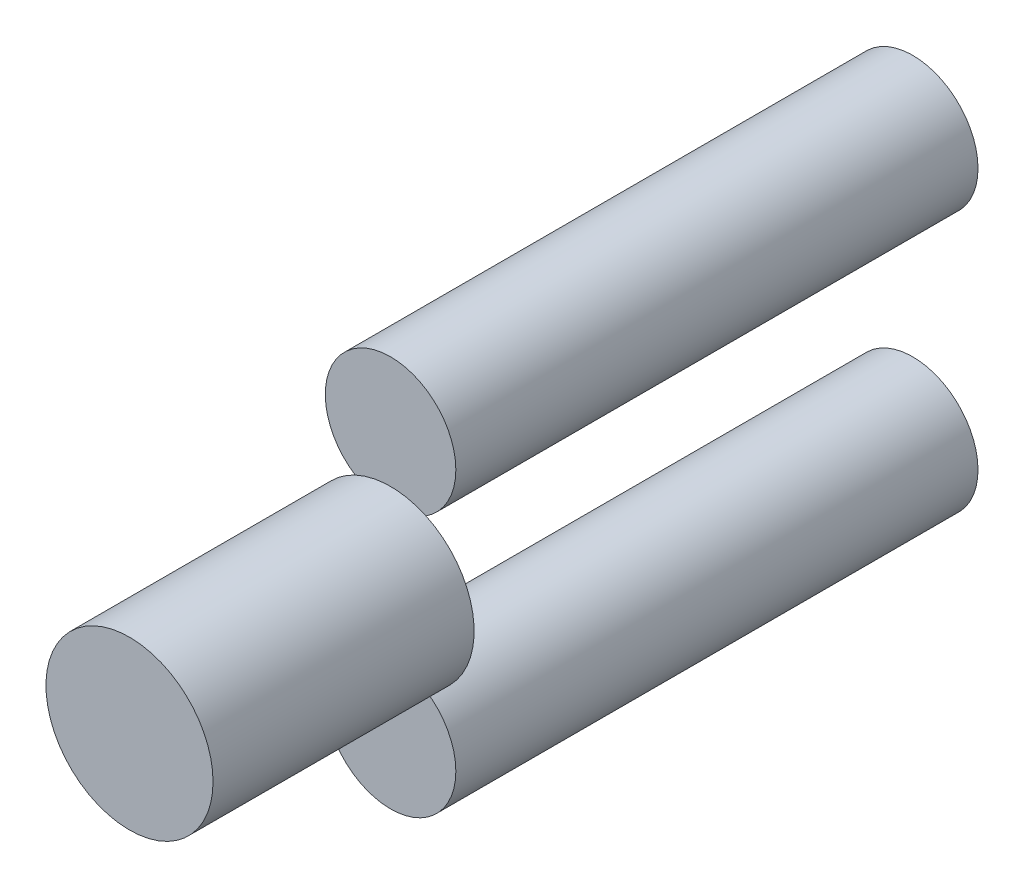
from build123d import *

# Parameters (mm, degrees)
SKETCH1_R             = 1.5875
BOSS_EXTRUDE1_DEPTH   = 12.7
BOSS_EXTRUDE1_2_DEPTH = 12.7
SKETCH2_R             = 2.032
BOSS_EXTRUDE2_DEPTH   = 6.35


with BuildPart() as part:
    # Sketch1 → Boss-Extrude1 (new body)
    with BuildSketch(Plane.XY):
        with Locations((0, 12.7)):
            Circle(SKETCH1_R)
    extrude(amount=-BOSS_EXTRUDE1_DEPTH)



with BuildPart() as body_2:
    # Sketch1 → Boss-Extrude1 2 (new body)
    with BuildSketch(Plane.XY):
        with Locations((0, 19.05)):
            Circle(SKETCH1_R)
    extrude(amount=-BOSS_EXTRUDE1_2_DEPTH)


with BuildPart() as part_1:
    add(part.part)

    add(body_2.part)  # Boss-Extrude2 merges body 2
    # Sketch2 → Boss-Extrude2 (add)
    with BuildSketch(Plane.XY):
        with Locations((0, 15.875)):
            Circle(SKETCH2_R)
    extrude(amount=BOSS_EXTRUDE2_DEPTH)


solid = part_1.part
